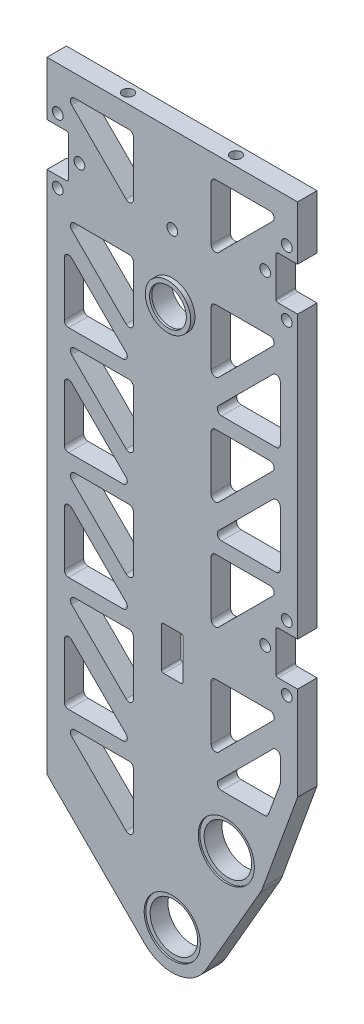
from build123d import *

# Parameters (mm, degrees)
SKETCH_1_R                   = 11
EXTRUDE_569_DEPTH            = 100
EXTRUDE_START                = -100
SKETCH_2_R                   = 11
EXTRUDE_878_DEPTH            = 100
EXTRUDE_2694_DEPTH           = 100
CUT_EXTRUDE_4151_DEPTH       = 534.010318849
CUT_EXTRUDE_4151_DEPTH_BACK  = 534.010318849
SKETCH_3_W                   = 90
SKETCH_3_H                   = 380
SKETCH_5_R                   = 2.5
EXTRUDE_4717_DEPTH           = 100
SKETCH_6_W                   = 191.177045066
SKETCH_6_H                   = 235.084722287
CUT_EXTRUDE_5031_DEPTH       = 84
SKETCH_7_R                   = 75
EXTRUDE_5319_DEPTH           = 5
CUT_EXTRUDE_6101_DEPTH       = 357.195171219
CUT_EXTRUDE_6101_DEPTH_BACK  = 357.195171219
FILLET_2_R                   = 2
MIRROR_START                 = 95
MIRROR_1_DEPTH               = 5
CUT_EXTRUDE_11154_DEPTH      = 357.195171219
CUT_EXTRUDE_11154_DEPTH_BACK = 357.195171219
SKETCH_12_W                  = 10
SKETCH_12_H                  = 20
FILLET_3_R                   = 1
CUT_EXTRUDE_START            = -5
CUT_EXTRUDE_12035_OUTLINE_R  = 5
CUT_EXTRUDE_12035_DEPTH      = 5
CUT_EXTRUDE_7_DEPTH          = 357.195171219
CUT_EXTRUDE_7_DEPTH_BACK     = 357.195171219
SKETCH_14_W                  = 10
SKETCH_14_H                  = 20
FILLET_4_R                   = 1
CUT_EXTRUDE_START_2          = -129
SKETCH_15_R                  = 11
CUT_EXTRUDE_8_DEPTH          = 129
SKETCH_16_R                  = 13
CUT_EXTRUDE_9_DEPTH          = 0.75
CUT_EXTRUDE_START_3          = -0.75
SKETCH_17_R                  = 13
CUT_EXTRUDE_10_DEPTH         = 0.75
SKETCH_18_R                  = 9.5
CUT_EXTRUDE_11_DEPTH         = 113
CUT_EXTRUDE_12_DEPTH         = 357.195171219
CUT_EXTRUDE_12_DEPTH_BACK    = 357.195171219
MOVE_FACE_1_BY               = 4
SKETCH_21_R                  = 2.5
CUT_EXTRUDE_13_DEPTH         = 17
SKETCH_22_R                  = 2.5
CUT_EXTRUDE_14_DEPTH         = 17
CUT_EXTRUDE_15_DEPTH         = 326.338285481
CUT_EXTRUDE_15_DEPTH_BACK    = 326.338285481
SKETCH_23_R                  = 2.5


# Read off the part's stored shape, not the designer's step: 镜向1, 电机安装轴承孔
with BuildPart() as part:
    # 草图1 → Extrude 569 (new body)
    with BuildSketch(Plane.XY):
        with BuildLine():
            Line((-18, 500), (-18, 0))
            ThreePointArc((-18, 0), (0, -18), (18, 0))
            Line((18, 0), (18, 500))
            ThreePointArc((18, 500), (0, 518), (-18, 500))
        make_face()
        with Locations((0, 500)):
            Circle(SKETCH_1_R, mode=Mode.SUBTRACT)
        Circle(SKETCH_1_R, mode=Mode.SUBTRACT)
    extrude(amount=EXTRUDE_569_DEPTH)

    # 草图2 → Extrude 878 (add)
    with BuildSketch(Plane.XY.offset(100).offset(EXTRUDE_START)):
        with BuildLine():
            Line((18, 61.301270189), (25, 61.301270189))
            ThreePointArc((25, 61.301270189), (40.588457268, 52.301270189), (40.588457268, 34.301270189))
            Line((40.588457268, 34.301270189), (15.588457268, -9))
            ThreePointArc((15.588457268, -9), (-4.658742812, -17.386664873), (-18, 0))
            Line((-18, 0), (-18, 61.301270189))
            Line((-18, 61.301270189), (18, 61.301270189))
        make_face()
        with Locations((25, 43.301270189)):
            Circle(SKETCH_2_R, mode=Mode.SUBTRACT)
        Circle(SKETCH_2_R, mode=Mode.SUBTRACT)
    extrude(amount=EXTRUDE_878_DEPTH)

    # 草图10 → Extrude 2694 (add)
    with BuildSketch(Plane(origin=(0, 0, 0), x_dir=(-1, 0, 0), z_dir=(0, 0, -1))):
        with BuildLine():
            Line((-41.914467174, 37.144907609), (-58, 81.339545828))
            Line((-58, 81.339545828), (-58, 320))
            Line((-58, 320), (-18, 320))
            Line((-18, 320), (-18, 61.301270189))
            Line((-18, 61.301270189), (-25, 61.301270189))
            ThreePointArc((-25, 61.301270189), (-39.744736797, 53.625646044), (-41.914467174, 37.144907609))
        make_face()
        with BuildLine():
            Line((12.727922061, -12.727922061), (58, 32.544155877))
            Line((58, 32.544155877), (58, 320))
            Line((58, 320), (18, 320))
            Line((18, 320), (18, 0))
            ThreePointArc((18, 0), (16.629831585, -6.888301783), (12.727922061, -12.727922061))
        make_face()
    extrude(amount=-EXTRUDE_2694_DEPTH)

    # 草图3 → Cut-Extrude 4151 (cut, two sides: drawn at the far end of the back side and taken through both)
    with BuildSketch(Plane.ZY.offset(18).offset(-CUT_EXTRUDE_4151_DEPTH_BACK)):
        with Locations((50, 150)):
            Rectangle(SKETCH_3_W, SKETCH_3_H)
    extrude(amount=CUT_EXTRUDE_4151_DEPTH + CUT_EXTRUDE_4151_DEPTH_BACK, mode=Mode.SUBTRACT)

    # 草图5 → Extrude 4717 (add)
    with BuildSketch(Plane.XY.offset(100)):
        with Locations(Location((0, 250, 0), (0, 0, 90))):
            Circle(SKETCH_5_R)
    extrude(amount=-EXTRUDE_4717_DEPTH)

    # 草图6 → Cut-Extrude 5031 (cut)
    with BuildSketch(Plane(origin=(18, 0, 0), x_dir=(0, 0, -1), z_dir=(1, 0, 0))):
        with Locations((-50.962374235, 437.542361144)):
            Rectangle(SKETCH_6_W, SKETCH_6_H)
    extrude(amount=-CUT_EXTRUDE_5031_DEPTH, mode=Mode.SUBTRACT)

    # 草图7 → Extrude 5319 (add)
    with BuildSketch(Plane(origin=(0, 320, 0), x_dir=(1, 0, 0), z_dir=(0, 1, 0))):
        with Locations(Location((0, -50, 0), (0, 0, 320.654170234))):
            Circle(SKETCH_7_R)
    extrude(amount=EXTRUDE_5319_DEPTH)

    # 草图10<3> → Cut-Extrude 6101 (cut, two sides: drawn at the far end of the back side and taken through both)
    with BuildSketch(Plane(origin=(0, 0, 0), x_dir=(-1, 0, 0), z_dir=(0, 0, -1)).offset(-CUT_EXTRUDE_6101_DEPTH_BACK)):
        Polygon((50, 310), (18, 310), (18, 278), align=None)
        Polygon((-18, 278), (-18, 310), (-50, 310), align=None)
        Polygon((-18, 227.925713543), (-18, 259.925713543), (-50, 259.925713543), align=None)
        Polygon((50, 259.925713543), (18, 259.925713543), (18, 227.925713543), align=None)
        Polygon((50, 248.612005044), (50, 216.612005044), (18, 216.612005044), align=None)
        Polygon((-50, 248.612005044), (-50, 216.612005044), (-18, 216.612005044), align=None)
        Polygon((-18, 177.851427085), (-18, 209.851427085), (-50, 209.851427085), align=None)
        Polygon((50, 209.851427085), (18, 209.851427085), (18, 177.851427085), align=None)
        Polygon((50, 198.537718586), (50, 166.537718586), (18, 166.537718586), align=None)
        Polygon((-50, 198.537718586), (-50, 166.537718586), (-18, 166.537718586), align=None)
        Polygon((-50, 159.777140628), (-18, 127.777140628), (-18, 159.777140628), align=None)
        Polygon((18, 159.777140628), (18, 127.777140628), (50, 159.777140628), align=None)
        Polygon((-50, 109.702854171), (-18, 77.702854171), (-18, 109.702854171), align=None)
        Polygon((18, 109.702854171), (18, 77.702854171), (50, 109.702854171), align=None)
        Polygon((-50, 98.389145672), (-50, 82.750161674), (-44.045077173, 66.389145672), (-18, 66.389145672), align=None)
        Polygon((18, 56.800140588), (18, 24.800140588), (50, 56.800140588), align=None)
        Polygon((50, 95.560718547), (50, 63.560718547), (18, 63.560718547), align=None)
        Polygon((50, 116.463432129), (18, 116.463432129), (50, 148.463432129), align=None)
    extrude(amount=CUT_EXTRUDE_6101_DEPTH + CUT_EXTRUDE_6101_DEPTH_BACK, mode=Mode.SUBTRACT)

    # 圆角2
    fillet_2_edges = [part.edges().sort_by_distance(p)[0] for p in [
        (50, 109.702854171, 2.5),
        (18, 109.702854171, 2.5),
        (18, 77.702854171, 2.5),
        (-18, 159.777140628, 2.5),
        (-50, 159.777140628, 2.5),
        (-18, 127.777140628, 2.5),
        (50, 159.777140628, 2.5),
        (18, 159.777140628, 2.5),
        (18, 127.777140628, 2.5),
        (50, 166.537718586, 2.5),
        (50, 198.537718586, 2.5),
        (18, 166.537718586, 2.5),
        (-50, 63.560718547, 2.5),
        (-18, 63.560718547, 2.5),
        (-50, 95.560718547, 2.5),
        (-50, 56.800140588, 2.5),
        (-18, 24.800140588, 2.5),
        (-18, 56.800140588, 2.5),
        (50, 82.750161674, 2.5),
        (50, 98.389145672, 2.5),
        (18, 66.389145672, 2.5),
        (44.045077173, 66.389145672, 2.5),
        (-18, 109.702854171, 2.5),
        (-50, 109.702854171, 2.5),
        (-18, 77.702854171, 2.5),
        (50, 310, 2.5),
        (18, 310, 2.5),
        (18, 278, 2.5),
        (50, 259.925713543, 2.5),
        (18, 259.925713543, 2.5),
        (18, 227.925713543, 2.5),
        (-50, 248.612005044, 2.5),
        (-50, 216.612005044, 2.5),
        (-18, 216.612005044, 2.5),
        (-18, 259.925713543, 2.5),
        (-50, 259.925713543, 2.5),
        (-18, 227.925713543, 2.5),
        (50, 216.612005044, 2.5),
        (50, 248.612005044, 2.5),
        (18, 216.612005044, 2.5),
        (50, 209.851427085, 2.5),
        (18, 209.851427085, 2.5),
        (18, 177.851427085, 2.5),
        (-50, 198.537718586, 2.5),
        (-50, 166.537718586, 2.5),
        (-18, 166.537718586, 2.5),
        (-18, 209.851427085, 2.5),
        (-50, 209.851427085, 2.5),
        (-18, 177.851427085, 2.5),
        (-50, 148.463432129, 2.5),
        (-50, 116.463432129, 2.5),
        (-18, 116.463432129, 2.5),
        (-18, 310, 2.5),
        (-50, 310, 2.5),
        (-18, 278, 2.5),
    ]]
    fillet(fillet_2_edges, radius=FILLET_2_R)

    # 镜向1 outline → 镜向1 (add)
    with BuildSketch(Plane.XY.offset(MIRROR_START)):
        with BuildLine():
            ThreePointArc((-50, 143.635005004), (-48.765366865, 145.482764069), (-46.585786438, 145.049218567))
            Line((-46.585786438, 145.049218567), (-50, 148.463432129))
            Line((-50, 148.463432129), (-50, 143.635005004))
        make_face()
        with BuildLine():
            Line((-18, 116.463432129), (-21.414213562, 119.877645691))
            ThreePointArc((-21.414213562, 119.877645691), (-20.98066806, 117.698065264), (-22.828427125, 116.463432129))
            Line((-22.828427125, 116.463432129), (-18, 116.463432129))
        make_face()
        with BuildLine():
            ThreePointArc((-48, 116.463432129), (-49.414213562, 117.049218567), (-50, 118.463432129))
            Line((-50, 118.463432129), (-50, 116.463432129))
            Line((-50, 116.463432129), (-48, 116.463432129))
        make_face()
        with BuildLine():
            ThreePointArc((-20, 310), (-18.585786438, 309.414213562), (-18, 308))
            Line((-18, 308), (-18, 310))
            Line((-18, 310), (-20, 310))
        make_face()
        with BuildLine():
            Line((-18, 278), (-18, 282.828427125))
            ThreePointArc((-18, 282.828427125), (-19.234633135, 280.98066806), (-21.414213562, 281.414213562))
            Line((-21.414213562, 281.414213562), (-18, 278))
        make_face()
        with BuildLine():
            ThreePointArc((-46.585786438, 306.585786438), (-47.01933194, 308.765366865), (-45.171572875, 310))
            Line((-45.171572875, 310), (-50, 310))
            Line((-50, 310), (-46.585786438, 306.585786438))
        make_face()
        with BuildLine():
            ThreePointArc((-20, 259.925713543), (-18.585786438, 259.339927105), (-18, 257.925713543))
            Line((-18, 257.925713543), (-18, 259.925713543))
            Line((-18, 259.925713543), (-20, 259.925713543))
        make_face()
        with BuildLine():
            Line((-18, 227.925713543), (-18, 232.754140667))
            ThreePointArc((-18, 232.754140667), (-19.234633135, 230.906381602), (-21.414213562, 231.339927105))
            Line((-21.414213562, 231.339927105), (-18, 227.925713543))
        make_face()
        with BuildLine():
            ThreePointArc((-46.585786438, 256.51149998), (-47.01933194, 258.691080407), (-45.171572875, 259.925713543))
            Line((-45.171572875, 259.925713543), (-50, 259.925713543))
            Line((-50, 259.925713543), (-46.585786438, 256.51149998))
        make_face()
        with BuildLine():
            ThreePointArc((-50, 243.783577919), (-48.765366865, 245.631336984), (-46.585786438, 245.197791481))
            Line((-46.585786438, 245.197791481), (-50, 248.612005044))
            Line((-50, 248.612005044), (-50, 243.783577919))
        make_face()
        with BuildLine():
            Line((-18, 216.612005044), (-21.414213562, 220.026218606))
            ThreePointArc((-21.414213562, 220.026218606), (-20.98066806, 217.846638179), (-22.828427125, 216.612005044))
            Line((-22.828427125, 216.612005044), (-18, 216.612005044))
        make_face()
        with BuildLine():
            ThreePointArc((-48, 216.612005044), (-49.414213563, 217.197791481), (-50, 218.612005044))
            Line((-50, 218.612005044), (-50, 216.612005044))
            Line((-50, 216.612005044), (-48, 216.612005044))
        make_face()
        with BuildLine():
            ThreePointArc((-20, 209.851427085), (-18.585786438, 209.265640647), (-18, 207.851427085))
            Line((-18, 207.851427085), (-18, 209.851427085))
            Line((-18, 209.851427085), (-20, 209.851427085))
        make_face()
        with BuildLine():
            Line((-18, 177.851427085), (-18, 182.67985421))
            ThreePointArc((-18, 182.67985421), (-19.234633135, 180.832095145), (-21.414213562, 181.265640648))
            Line((-21.414213562, 181.265640648), (-18, 177.851427085))
        make_face()
        with BuildLine():
            ThreePointArc((-46.585786438, 206.437213523), (-47.01933194, 208.61679395), (-45.171572875, 209.851427085))
            Line((-45.171572875, 209.851427085), (-50, 209.851427085))
            Line((-50, 209.851427085), (-46.585786438, 206.437213523))
        make_face()
        with BuildLine():
            ThreePointArc((-50, 193.709291462), (-48.765366865, 195.557050527), (-46.585786438, 195.123505024))
            Line((-46.585786438, 195.123505024), (-50, 198.537718586))
            Line((-50, 198.537718586), (-50, 193.709291462))
        make_face()
        with BuildLine():
            Line((-18, 166.537718586), (-21.414213562, 169.951932149))
            ThreePointArc((-21.414213562, 169.951932149), (-20.98066806, 167.772351722), (-22.828427125, 166.537718586))
            Line((-22.828427125, 166.537718586), (-18, 166.537718586))
        make_face()
        with BuildLine():
            ThreePointArc((-48, 166.537718586), (-49.414213562, 167.123505024), (-50, 168.537718586))
            Line((-50, 168.537718586), (-50, 166.537718586))
            Line((-50, 166.537718586), (-48, 166.537718586))
        make_face()
        with BuildLine():
            ThreePointArc((-20, 159.777140628), (-18.585786438, 159.19135419), (-18, 157.777140628))
            Line((-18, 157.777140628), (-18, 159.777140628))
            Line((-18, 159.777140628), (-20, 159.777140628))
        make_face()
        with BuildLine():
            Line((-18, 127.777140628), (-18, 132.605567753))
            ThreePointArc((-18, 132.605567753), (-19.234633135, 130.757808688), (-21.414213562, 131.19135419))
            Line((-21.414213562, 131.19135419), (-18, 127.777140628))
        make_face()
        with BuildLine():
            ThreePointArc((-46.585786438, 156.362927066), (-47.01933194, 158.542507493), (-45.171572875, 159.777140628))
            Line((-45.171572875, 159.777140628), (-50, 159.777140628))
            Line((-50, 159.777140628), (-46.585786438, 156.362927066))
        make_face()
        with BuildLine():
            ThreePointArc((-20, 109.702854171), (-18.585786438, 109.117067733), (-18, 107.702854171))
            Line((-18, 107.702854171), (-18, 109.702854171))
            Line((-18, 109.702854171), (-20, 109.702854171))
        make_face()
        with BuildLine():
            Line((-18, 77.702854171), (-18, 82.531281295))
            ThreePointArc((-18, 82.531281295), (-19.234633135, 80.68352223), (-21.414213562, 81.117067733))
            Line((-21.414213562, 81.117067733), (-18, 77.702854171))
        make_face()
        with BuildLine():
            ThreePointArc((-46.585786438, 106.288640608), (-47.01933194, 108.468221035), (-45.171572875, 109.702854171))
            Line((-45.171572875, 109.702854171), (-50, 109.702854171))
            Line((-50, 109.702854171), (-46.585786438, 106.288640608))
        make_face()
        with BuildLine():
            ThreePointArc((-50, 90.732291422), (-48.765366865, 92.580050487), (-46.585786438, 92.146504984))
            Line((-46.585786438, 92.146504984), (-50, 95.560718547))
            Line((-50, 95.560718547), (-50, 90.732291422))
        make_face()
        with BuildLine():
            Line((-18, 63.560718547), (-21.414213562, 66.974932109))
            ThreePointArc((-21.414213562, 66.974932109), (-20.98066806, 64.795351682), (-22.828427125, 63.560718547))
            Line((-22.828427125, 63.560718547), (-18, 63.560718547))
        make_face()
        with BuildLine():
            ThreePointArc((-48, 63.560718547), (-49.414213562, 64.146504984), (-50, 65.560718547))
            Line((-50, 65.560718547), (-50, 63.560718547))
            Line((-50, 63.560718547), (-48, 63.560718547))
        make_face()
        with BuildLine():
            ThreePointArc((-46.585786438, 53.385927026), (-47.01933194, 55.565507453), (-45.171572875, 56.800140588))
            Line((-45.171572875, 56.800140588), (-50, 56.800140588))
            Line((-50, 56.800140588), (-46.585786438, 53.385927026))
        make_face()
        with BuildLine():
            Line((-18, 56.800140588), (-20, 56.800140588))
            ThreePointArc((-20, 56.800140588), (-18.585786437, 56.214354151), (-18, 54.800140588))
            Line((-18, 54.800140588), (-18, 56.800140588))
        make_face()
        with BuildLine():
            ThreePointArc((-18, 29.628567713), (-19.234633135, 27.780808648), (-21.414213562, 28.214354151))
            Line((-21.414213562, 28.214354151), (-18, 24.800140588))
            Line((-18, 24.800140588), (-18, 29.628567713))
        make_face()
        with BuildLine():
            ThreePointArc((46.585786438, 94.974932109), (48.765366865, 95.408477612), (50, 93.560718547))
            Line((50, 93.560718547), (50, 98.389145672))
            Line((50, 98.389145672), (46.585786438, 94.974932109))
        make_face()
        with BuildLine():
            Line((50, 82.750161674), (50, 83.102815635))
            ThreePointArc((50, 83.102815635), (49.969615506, 82.75551928), (49.879385242, 82.418775349))
            Line((49.879385242, 82.418775349), (50, 82.750161674))
        make_face()
        with BuildLine():
            ThreePointArc((22.828427125, 66.389145672), (20.98066806, 67.623778807), (21.414213562, 69.803359234))
            Line((21.414213562, 69.803359234), (18, 66.389145672))
            Line((18, 66.389145672), (22.828427125, 66.389145672))
        make_face()
        with BuildLine():
            Line((44.045077173, 66.389145672), (44.524047338, 67.705105385))
            ThreePointArc((44.524047338, 67.705105385), (43.791814969, 66.750841583), (42.644662096, 66.389145672))
            Line((42.644662096, 66.389145672), (44.045077173, 66.389145672))
        make_face()
        with BuildLine():
            Line((18, 109.702854171), (18, 107.702854171))
            ThreePointArc((18, 107.702854171), (18.585786438, 109.117067733), (20, 109.702854171))
            Line((20, 109.702854171), (18, 109.702854171))
        make_face()
        with BuildLine():
            ThreePointArc((21.414213562, 81.117067733), (19.234633135, 80.68352223), (18, 82.531281295))
            Line((18, 82.531281295), (18, 77.702854171))
            Line((18, 77.702854171), (21.414213562, 81.117067733))
        make_face()
        with BuildLine():
            Line((50, 109.702854171), (45.171572875, 109.702854171))
            ThreePointArc((45.171572875, 109.702854171), (47.01933194, 108.468221035), (46.585786438, 106.288640608))
            Line((46.585786438, 106.288640608), (50, 109.702854171))
        make_face()
        with BuildLine():
            Line((18, 159.777140628), (18, 157.777140628))
            ThreePointArc((18, 157.777140628), (18.585786438, 159.19135419), (20, 159.777140628))
            Line((20, 159.777140628), (18, 159.777140628))
        make_face()
        with BuildLine():
            ThreePointArc((21.414213562, 131.19135419), (19.234633135, 130.757808688), (18, 132.605567753))
            Line((18, 132.605567753), (18, 127.777140628))
            Line((18, 127.777140628), (21.414213562, 131.19135419))
        make_face()
        with BuildLine():
            Line((50, 159.777140628), (45.171572875, 159.777140628))
            ThreePointArc((45.171572875, 159.777140628), (47.01933194, 158.542507493), (46.585786438, 156.362927066))
            Line((46.585786438, 156.362927066), (50, 159.777140628))
        make_face()
        with BuildLine():
            ThreePointArc((50, 168.537718586), (49.414213562, 167.123505024), (48, 166.537718586))
            Line((48, 166.537718586), (50, 166.537718586))
            Line((50, 166.537718586), (50, 168.537718586))
        make_face()
        with BuildLine():
            Line((18, 166.537718586), (22.828427125, 166.537718586))
            ThreePointArc((22.828427125, 166.537718586), (20.98066806, 167.772351722), (21.414213562, 169.951932149))
            Line((21.414213562, 169.951932149), (18, 166.537718586))
        make_face()
        with BuildLine():
            ThreePointArc((46.585786438, 195.123505024), (48.765366865, 195.557050527), (50, 193.709291462))
            Line((50, 193.709291462), (50, 198.537718586))
            Line((50, 198.537718586), (46.585786438, 195.123505024))
        make_face()
        with BuildLine():
            Line((18, 177.851427085), (21.414213562, 181.265640648))
            ThreePointArc((21.414213562, 181.265640648), (19.234633135, 180.832095145), (18, 182.67985421))
            Line((18, 182.67985421), (18, 177.851427085))
        make_face()
        with BuildLine():
            ThreePointArc((45.171572875, 209.851427085), (47.01933194, 208.61679395), (46.585786438, 206.437213523))
            Line((46.585786438, 206.437213523), (50, 209.851427085))
            Line((50, 209.851427085), (45.171572875, 209.851427085))
        make_face()
        with BuildLine():
            Line((18, 209.851427085), (18, 207.851427085))
            ThreePointArc((18, 207.851427085), (18.585786438, 209.265640647), (20, 209.851427085))
            Line((20, 209.851427085), (18, 209.851427085))
        make_face()
        with BuildLine():
            ThreePointArc((50, 218.612005044), (49.414213563, 217.197791481), (48, 216.612005044))
            Line((48, 216.612005044), (50, 216.612005044))
            Line((50, 216.612005044), (50, 218.612005044))
        make_face()
        with BuildLine():
            Line((18, 216.612005044), (22.828427125, 216.612005044))
            ThreePointArc((22.828427125, 216.612005044), (20.98066806, 217.846638179), (21.414213562, 220.026218606))
            Line((21.414213562, 220.026218606), (18, 216.612005044))
        make_face()
        with BuildLine():
            ThreePointArc((46.585786438, 245.197791481), (48.765366865, 245.631336984), (50, 243.783577919))
            Line((50, 243.783577919), (50, 248.612005044))
            Line((50, 248.612005044), (46.585786438, 245.197791481))
        make_face()
        with BuildLine():
            Line((18, 227.925713543), (21.414213562, 231.339927105))
            ThreePointArc((21.414213562, 231.339927105), (19.234633135, 230.906381602), (18, 232.754140667))
            Line((18, 232.754140667), (18, 227.925713543))
        make_face()
        with BuildLine():
            ThreePointArc((45.171572875, 259.925713543), (47.01933194, 258.691080407), (46.585786438, 256.51149998))
            Line((46.585786438, 256.51149998), (50, 259.925713543))
            Line((50, 259.925713543), (45.171572875, 259.925713543))
        make_face()
        with BuildLine():
            Line((18, 259.925713543), (18, 257.925713543))
            ThreePointArc((18, 257.925713543), (18.585786438, 259.339927105), (20, 259.925713543))
            Line((20, 259.925713543), (18, 259.925713543))
        make_face()
        with BuildLine():
            Line((18, 278), (21.414213562, 281.414213562))
            ThreePointArc((21.414213562, 281.414213562), (19.234633135, 280.98066806), (18, 282.828427125))
            Line((18, 282.828427125), (18, 278))
        make_face()
        with BuildLine():
            ThreePointArc((45.171572875, 310), (47.01933194, 308.765366865), (46.585786438, 306.585786438))
            Line((46.585786438, 306.585786438), (50, 310))
            Line((50, 310), (45.171572875, 310))
        make_face()
        with BuildLine():
            Line((18, 310), (18, 308))
            ThreePointArc((18, 308), (18.585786438, 309.414213562), (20, 310))
            Line((20, 310), (18, 310))
        make_face()
    extrude(amount=MIRROR_1_DEPTH)

    # 草图12 → Cut-Extrude 11154 (cut, two sides: drawn at the far end of the back side and taken through both)
    with BuildSketch(Plane(origin=(0, 0, 0), x_dir=(-1, 0, 0), z_dir=(0, 0, -1)).offset(-CUT_EXTRUDE_11154_DEPTH_BACK)):
        with Locations((-53, 285)):
            Rectangle(SKETCH_12_W, SKETCH_12_H)
        with Locations((-53, 134.702854171)):
            Rectangle(SKETCH_12_W, SKETCH_12_H)
        with Locations((53, 285)):
            Rectangle(SKETCH_12_W, SKETCH_12_H)
    extrude(amount=CUT_EXTRUDE_11154_DEPTH + CUT_EXTRUDE_11154_DEPTH_BACK, mode=Mode.SUBTRACT)

    # 圆角3
    fillet_3_edges = [part.edges().sort_by_distance(p)[0] for p in [
        (-48, 275, 2.5),
        (-48, 295, 2.5),
        (-48, 275, 97.5),
        (-48, 295, 97.5),
        (48, 144.702854171, 2.5),
        (48, 124.702854171, 2.5),
        (48, 144.702854171, 97.5),
        (48, 124.702854171, 97.5),
        (48, 295, 2.5),
        (48, 275, 2.5),
        (48, 295, 97.5),
        (48, 275, 97.5),
    ]]
    fillet(fillet_3_edges, radius=FILLET_3_R)

    # Cut-Extrude 12035 outline → Cut-Extrude 12035 (cut)
    with BuildSketch(Plane.XY.offset(5).offset(CUT_EXTRUDE_START)):
        with Locations((0, 250)):
            Circle(CUT_EXTRUDE_12035_OUTLINE_R)
    cut_extrude_12035 = extrude(amount=CUT_EXTRUDE_12035_DEPTH, mode=Mode.SUBTRACT)

    # 镜向2: Cut-Extrude 12035 across plane
    add(cut_extrude_12035.mirror(Plane(origin=(0, 0, 50), x_dir=(1, 0, 0), z_dir=(0, 0, -1))), mode=Mode.SUBTRACT)

    # 草图14 → 切除-拉伸7 (cut, two sides: drawn at the far end of the back side and taken through both)
    with BuildSketch(Plane(origin=(0, 0, 0), x_dir=(-1, 0, 0), z_dir=(0, 0, -1)).offset(-CUT_EXTRUDE_7_DEPTH_BACK)):
        with Locations((0, 110)):
            Rectangle(SKETCH_14_W, SKETCH_14_H)
    extrude(amount=CUT_EXTRUDE_7_DEPTH + CUT_EXTRUDE_7_DEPTH_BACK, mode=Mode.SUBTRACT)

    # 圆角4
    fillet_4_edges = [part.edges().sort_by_distance(p)[0] for p in [
        (5, 100, 2.5),
        (5, 120, 2.5),
        (-5, 120, 2.5),
        (-5, 100, 2.5),
        (5, 100, 97.5),
        (5, 120, 97.5),
        (-5, 120, 97.5),
        (-5, 100, 97.5),
    ]]
    fillet(fillet_4_edges, radius=FILLET_4_R)

    # 草图15 → 切除-拉伸8 (cut)
    with BuildSketch(Plane.XY.offset(100).offset(CUT_EXTRUDE_START_2)):
        with Locations((25, 43.301270189)):
            Circle(SKETCH_15_R)
    extrude(amount=CUT_EXTRUDE_8_DEPTH, mode=Mode.SUBTRACT)

    # 草图16 → 切除-拉伸9 (cut)
    with BuildSketch(Plane.XY.offset(100)):
        with Locations((25, 43.301270189)):
            Circle(SKETCH_16_R)
        Circle(SKETCH_16_R)
    extrude(amount=-CUT_EXTRUDE_9_DEPTH, mode=Mode.SUBTRACT)

    # 草图17 → 切除-拉伸10 (cut)
    with BuildSketch(Plane(origin=(0, 0, 0), x_dir=(-1, 0, 0), z_dir=(0, 0, -1)).offset(CUT_EXTRUDE_START_3)):
        with Locations(Location((0, 0, 0), (0, 0, 180))):
            Circle(SKETCH_17_R)
        with Locations(Location((-25, 43.301270189, 0), (0, 0, 180))):
            Circle(SKETCH_17_R)
    extrude(amount=CUT_EXTRUDE_10_DEPTH, mode=Mode.SUBTRACT)

    # 草图18 → 切除-拉伸11 (cut)
    with BuildSketch(Plane.XY.offset(100)):
        with Locations((0, 250)):
            Circle(SKETCH_18_R)
    extrude(amount=-CUT_EXTRUDE_11_DEPTH, mode=Mode.SUBTRACT)

    # 草图19 → 旋转1 (revolve)
    with BuildSketch(Plane(origin=(0, 0, 0), x_dir=(0, 0, -1), z_dir=(1, 0, 0)), mode=Mode.PRIVATE) as revolve_1_sk:
        Polygon((0, 239.5), (2, 239.5), (2, 241.5), (1, 241.5), (1, 240.5), (0, 240.5), align=None)
        Polygon((-100, 239.5), (-102, 239.5), (-102, 241.5), (-101, 241.5), (-101, 240.5), (-100, 240.5), align=None)
    revolve(revolve_1_sk.sketch.rotate(Axis((0, 250, 0), (0, 0, 1)), 270), axis=Axis((0, 250, 0), (0, 0, 1)))

    # 草图20 → 切除-拉伸12 (cut, two sides: drawn at the far end of the back side and taken through both)
    with BuildSketch(Plane(origin=(0, 0, 0), x_dir=(0, 0, -1), z_dir=(1, 0, 0)).offset(-CUT_EXTRUDE_12_DEPTH_BACK)):
        Polygon((25, 325), (-125, 325), (-125, 320), (-25.33563281, 320), (-25.33563281, -69.714061667), (25, -69.714061667), align=None)
    extrude(amount=CUT_EXTRUDE_12_DEPTH + CUT_EXTRUDE_12_DEPTH_BACK, mode=Mode.SUBTRACT)

    # Move Face 1: a face moved outward by 4.0
    extrude(part.faces().sort_by_distance((-0.85211942, 163.36467429, 95))[0], amount=MOVE_FACE_1_BY, dir=(0, 0, -1))

    # 草图21 → 切除-拉伸13 (cut)
    with BuildSketch(Plane(origin=(0, 320, 0), x_dir=(1, 0, 0), z_dir=(0, 1, 0))):
        with Locations(Location((-25, -95.5, 0), (0, 0, 270))):
            Circle(SKETCH_21_R)
        with Locations(Location((25, -95.5, 0), (0, 0, 270))):
            Circle(SKETCH_21_R)
    extrude(amount=-CUT_EXTRUDE_13_DEPTH, mode=Mode.SUBTRACT)

    # 草图22 → 切除-拉伸14 (cut)
    with BuildSketch(Plane.XY.offset(100)):
        with Locations((0, 280)):
            Circle(SKETCH_22_R)
    extrude(amount=-CUT_EXTRUDE_14_DEPTH, mode=Mode.SUBTRACT)

    # 草图23 → 切除-拉伸15 (cut, two sides: drawn at the far end of the back side and taken through both)
    with BuildSketch(Plane.XY.offset(100).offset(-CUT_EXTRUDE_15_DEPTH_BACK)):
        with Locations((53, 300)):
            Circle(SKETCH_23_R)
        with Locations((43, 285)):
            Circle(SKETCH_23_R)
        with Locations((53, 270)):
            Circle(SKETCH_23_R)
        with Locations((-53, 300)):
            Circle(SKETCH_23_R)
        with Locations((-43, 285)):
            Circle(SKETCH_23_R)
        with Locations((-53, 270)):
            Circle(SKETCH_23_R)
        with Locations((53, 149.702854171)):
            Circle(SKETCH_23_R)
        with Locations((43, 134.702854171)):
            Circle(SKETCH_23_R)
        with Locations((53, 119.702854171)):
            Circle(SKETCH_23_R)
    extrude(amount=CUT_EXTRUDE_15_DEPTH + CUT_EXTRUDE_15_DEPTH_BACK, mode=Mode.SUBTRACT)


solid = part.part
